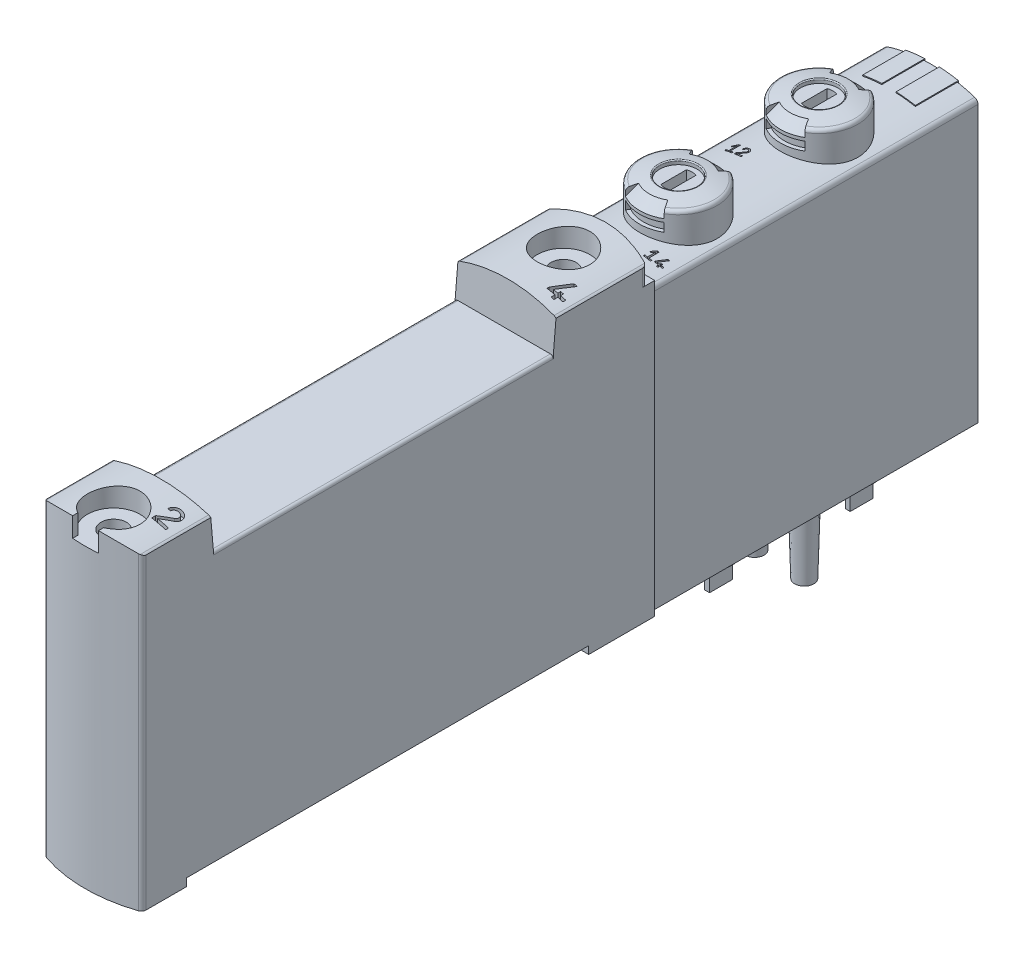
from build123d import *

# Parameters (mm, degrees)
BOSS_EXTRUDE1_DEPTH          = 34
CUT_EXTRUDE1_DEPTH           = 6
CUT_EXTRUDE1_DEPTH_BACK      = 6
SKETCH2_W                    = 34.1
SKETCH2_H                    = 0.4
CUT_EXTRUDE2_DEPTH           = 1.9
CUT_EXTRUDE3_DEPTH           = 1.9
SKETCH9_W                    = 0.5
SKETCH9_H                    = 2.4
BOSS_EXTRUDE2_DEPTH          = 2.5
SKETCH10_W                   = 0.5
SKETCH10_H                   = 2.4
BOSS_EXTRUDE3_DEPTH          = 2.5
SKETCH11_W                   = 0.5
SKETCH11_H                   = 2.4
BOSS_EXTRUDE4_DEPTH          = 2.5
SKETCH12_W                   = 0.5
SKETCH12_H                   = 2.4
BOSS_EXTRUDE5_DEPTH          = 2.5
CUT_REVOLVE1_ANGLE           = 30
CUT_REVOLVE1_OTHER_WAY_ANGLE = 30
CUT_REVOLVE2_ANGLE           = 30
CUT_REVOLVE2_OTHER_WAY_ANGLE = 30
CUT_EXTRUDE4_DEPTH           = 1.7
CUT_REVOLVE3_ANGLE           = 30
CUT_REVOLVE3_OTHER_WAY_ANGLE = 30
CUT_REVOLVE4_ANGLE           = 30
CUT_REVOLVE4_OTHER_WAY_ANGLE = 30
CUT_EXTRUDE5_DEPTH           = 1.7
BOSS_EXTRUDE6_DEPTH          = 4.5
BOSS_EXTRUDE7_DEPTH          = 4.5
BOSS_EXTRUDE8_DEPTH          = 33.1
CUT_EXTRUDE6_DEPTH           = 10
CUT_EXTRUDE6_DEPTH_BACK      = 10
CUT_EXTRUDE7_DEPTH           = 10
CUT_EXTRUDE8_DEPTH           = 10
CUT_EXTRUDE8_DEPTH_BACK      = 10
SKETCH26_W                   = 42
SKETCH26_H                   = 1
CUT_EXTRUDE9_DEPTH           = 55
CUT_EXTRUDE10_DEPTH          = 35.5
CUT_EXTRUDE11_DEPTH          = 2.1
CUT_EXTRUDE11_DEPTH_BACK     = 2.1
SKETCH30_W                   = 1.325
SKETCH30_H                   = 31
CUT_EXTRUDE12_DEPTH          = 3.5
CUT_EXTRUDE12_DEPTH_BACK     = 3.5
CUT_EXTRUDE13_DEPTH          = 3.5
CUT_EXTRUDE13_DEPTH_BACK     = 3.5
CUT_EXTRUDE14_DEPTH          = 3.5
CUT_EXTRUDE14_DEPTH_BACK     = 3.5
CUT_EXTRUDE15_DEPTH          = 3.5
CUT_EXTRUDE15_DEPTH_BACK     = 3.5
CUT_EXTRUDE16_DEPTH          = 1
CUT_EXTRUDE16_DEPTH_BACK     = 1
CUT_EXTRUDE17_DEPTH          = 1
CUT_EXTRUDE17_DEPTH_BACK     = 1


with BuildPart() as part:
    # Sketch1 → Boss-Extrude1 (new body)
    with BuildSketch(Plane.XY.offset(-23.2)):
        with BuildLine():
            Line((-4.9, 29.216294728), (-4.9, 0))
            Line((-4.9, 0), (4.9, 0))
            Line((4.9, 0), (4.9, 29.216294728))
            ThreePointArc((4.9, 29.216294728), (4.803647166, 29.511369236), (4.551724138, 29.692718684))
            ThreePointArc((4.551724138, 29.692718684), (0, 30.4), (-4.551724138, 29.692718684))
            ThreePointArc((-4.551724138, 29.692718684), (-4.803647166, 29.511369236), (-4.9, 29.216294728))
        make_face()
    extrude(amount=BOSS_EXTRUDE1_DEPTH)

    # Sketch2 → Cut-Extrude1 (cut, two sides: drawn at the far end of the back side and taken through both)
    with BuildSketch(Plane(origin=(0, 0, 0), x_dir=(0, 0, -1), z_dir=(1, 0, 0)).offset(-CUT_EXTRUDE1_DEPTH_BACK)):
        with Locations((6.17, 0.2)):
            Rectangle(SKETCH2_W, SKETCH2_H)
    extrude(amount=CUT_EXTRUDE1_DEPTH + CUT_EXTRUDE1_DEPTH_BACK, mode=Mode.SUBTRACT)

    # Sketch3 → Cut-Extrude2 (cut)
    with BuildSketch(Plane(origin=(0, 0, 0), x_dir=(1, 0, 0), z_dir=(0, 1, 0))):
        with BuildLine():
            Line((-3.15, 2.465258607), (-3.15, -2.465258607))
            ThreePointArc((-3.15, -2.465258607), (0, -4), (3.15, -2.465258607))
            Line((3.15, -2.465258607), (3.15, 2.465258607))
            ThreePointArc((3.15, 2.465258607), (0, 4), (-3.15, 2.465258607))
        make_face()
    extrude(amount=CUT_EXTRUDE2_DEPTH, mode=Mode.SUBTRACT)

    # Sketch4 → Cut-Extrude3 (cut)
    with BuildSketch(Plane(origin=(0, 0, 0), x_dir=(1, 0, 0), z_dir=(0, 1, 0))):
        with BuildLine():
            Line((-3.15, 17.165258607), (-3.15, 12.234741393))
            ThreePointArc((-3.15, 12.234741393), (0, 10.7), (3.15, 12.234741393))
            Line((3.15, 12.234741393), (3.15, 17.165258607))
            ThreePointArc((3.15, 17.165258607), (0, 18.7), (-3.15, 17.165258607))
        make_face()
    extrude(amount=CUT_EXTRUDE3_DEPTH, mode=Mode.SUBTRACT)

    # Sketch5 → Revolve1 (revolve)
    with BuildSketch(Plane(origin=(0, 0, 0), x_dir=(0, 0, -1), z_dir=(1, 0, 0))):
        Polygon((0, 2.1), (3.05, 2.1), (3.05, 1.1), (2.25, 1.1), (2.25, -1.4), (2.65, -1.4), (2.65, -1.72), (2.430606898, -2.1), (0, -2.1), align=None)
    revolve(axis=Axis((0, -2.1, 0), (0, 1, 0)))

    # Sketch6 → Revolve2 (revolve)
    with BuildSketch(Plane(origin=(0, 0, 0), x_dir=(0, 0, -1), z_dir=(1, 0, 0))):
        Polygon((14.7, 2.1), (17.75, 2.1), (17.75, 1.1), (16.95, 1.1), (16.95, -1.4), (17.35, -1.4), (17.35, -1.72), (17.130606898, -2.1), (14.7, -2.1), align=None)
    revolve(axis=Axis((0, -2.1, -14.7), (0, 1, 0)))

    # Sketch7 → Revolve3 (revolve)
    with BuildSketch(Plane.XY.offset(-7.35)):
        with BuildLine():
            Line((2.6, 0.4), (3.8, 0.4))
            Line((3.8, 0.4), (3.6, -6.9))
            ThreePointArc((3.6, -6.9), (3.106540729, -7.021444616), (2.6, -7.06227766))
            Line((2.6, -7.06227766), (2.6, 0.4))
        make_face()
    revolve(axis=Axis((2.6, -7.06227766, -7.35), (0, 1, 0)))

    # Sketch8 → Revolve4 (revolve)
    with BuildSketch(Plane.XY.offset(-7.35)):
        with BuildLine():
            Line((-2.6, 0.4), (-1.4, 0.4))
            Line((-1.4, 0.4), (-1.6, -6.9))
            ThreePointArc((-1.6, -6.9), (-2.093459271, -7.021444616), (-2.6, -7.06227766))
            Line((-2.6, -7.06227766), (-2.6, 0.4))
        make_face()
    revolve(axis=Axis((-2.6, -7.06227766, -7.35), (0, 1, 0)))

    # Sketch9 → Boss-Extrude2 (add)
    with BuildSketch(Plane(origin=(0, -2.1, 0), x_dir=(-1, 0, 0), z_dir=(0, -1, 0))):
        with Locations((-1, 0)):
            Rectangle(SKETCH9_W, SKETCH9_H)
    extrude(amount=BOSS_EXTRUDE2_DEPTH)

    # Sketch10 → Boss-Extrude3 (add)
    with BuildSketch(Plane(origin=(0, -2.1, 0), x_dir=(-1, 0, 0), z_dir=(0, -1, 0))):
        with Locations((1, 0)):
            Rectangle(SKETCH10_W, SKETCH10_H)
    extrude(amount=BOSS_EXTRUDE3_DEPTH)

    # Sketch11 → Boss-Extrude4 (add)
    with BuildSketch(Plane(origin=(0, -2.1, 0), x_dir=(-1, 0, 0), z_dir=(0, -1, 0))):
        with Locations((-1, 14.7)):
            Rectangle(SKETCH11_W, SKETCH11_H)
    extrude(amount=BOSS_EXTRUDE4_DEPTH)

    # Sketch12 → Boss-Extrude5 (add)
    with BuildSketch(Plane(origin=(0, -2.1, 0), x_dir=(-1, 0, 0), z_dir=(0, -1, 0))):
        with Locations((1, 14.7)):
            Rectangle(SKETCH12_W, SKETCH12_H)
    extrude(amount=BOSS_EXTRUDE5_DEPTH)

    # Sketch13 → Revolve5 (revolve)
    with BuildSketch(Plane(origin=(0, 0, 0), x_dir=(0, 0, -1), z_dir=(1, 0, 0))):
        with BuildLine():
            Line((-3.2, 33.13), (-1.25, 33.13))
            Line((-1.25, 33.13), (-1.25, 33.458302748))
            ThreePointArc((-1.25, 33.458302748), (-1.215666434, 33.533721045), (-1.136241611, 33.55735176))
            ThreePointArc((-1.136241611, 33.55735176), (-0.28833743, 33.414694053), (0.549999769, 33.223687608))
            ThreePointArc((0.549999769, 33.223687608), (0.766227693, 33.081338282), (0.85, 32.836389214))
            Line((0.85, 32.836389214), (0.85, 28.4))
            Line((0.85, 28.4), (-3.2, 28.4))
            Line((-3.2, 28.4), (-3.2, 33.13))
        make_face()
    revolve(axis=Axis((0, 28.4, 3.2), (0, 1, 0)))

    # Sketch14 → Revolve6 (revolve)
    with BuildSketch(Plane(origin=(0, 0, 0), x_dir=(0, 0, -1), z_dir=(1, 0, 0))):
        with BuildLine():
            Line((11.5, 33.13), (13.45, 33.13))
            Line((13.45, 33.13), (13.45, 33.458302748))
            ThreePointArc((13.45, 33.458302748), (13.484333566, 33.533721045), (13.563758389, 33.55735176))
            ThreePointArc((13.563758389, 33.55735176), (14.411662804, 33.414694007), (15.250000231, 33.223687489))
            ThreePointArc((15.250000231, 33.223687489), (15.466227839, 33.081338094), (15.55, 32.836389214))
            Line((15.55, 32.836389214), (15.55, 28.4))
            Line((15.55, 28.4), (11.5, 28.4))
            Line((11.5, 28.4), (11.5, 33.13))
        make_face()
    revolve(axis=Axis((0, 28.4, -11.5), (0, 1, 0)))

    # Sketch15 → Cut-Revolve1 (revolve, cut)
    with BuildSketch(Plane(origin=(0, 0, 0), x_dir=(0, 0, -1), z_dir=(1, 0, 0))):
        Polygon((-0.47, 33.7), (0.9, 32.33), (0.9, 32.05), (0.45, 32.05), (0.45, 31.15), (0.9, 31.15), (0.9, 30.5), (1.3, 30.5), (1.3, 33.7), align=None)
    revolve(axis=Axis((0, 30.5, 3.2), (0, -1, 0)), revolution_arc=CUT_REVOLVE1_ANGLE, mode=Mode.SUBTRACT)

    # Sketch15 → Cut-Revolve1 other way (revolve, cut)
    with BuildSketch(Plane(origin=(0, 0, 0), x_dir=(0, 0, -1), z_dir=(1, 0, 0))):
        Polygon((-0.47, 33.7), (0.9, 32.33), (0.9, 32.05), (0.45, 32.05), (0.45, 31.15), (0.9, 31.15), (0.9, 30.5), (1.3, 30.5), (1.3, 33.7), align=None)
    revolve(axis=Axis((0, 30.5, 3.2), (0, 1, 0)), revolution_arc=CUT_REVOLVE1_OTHER_WAY_ANGLE, mode=Mode.SUBTRACT)

    # Sketch16 → Cut-Revolve2 (revolve, cut)
    with BuildSketch(Plane(origin=(0, 0, 0), x_dir=(0, 0, -1), z_dir=(1, 0, 0))):
        Polygon((-7.7, 30.5), (-7.3, 30.5), (-7.3, 31.15), (-6.85, 31.15), (-6.85, 32.05), (-7.3, 32.05), (-7.3, 32.33), (-5.93, 33.7), (-7.7, 33.7), align=None)
    revolve(axis=Axis((0, 33.7, 3.2), (0, 1, 0)), revolution_arc=CUT_REVOLVE2_ANGLE, mode=Mode.SUBTRACT)

    # Sketch16 → Cut-Revolve2 other way (revolve, cut)
    with BuildSketch(Plane(origin=(0, 0, 0), x_dir=(0, 0, -1), z_dir=(1, 0, 0))):
        Polygon((-7.7, 30.5), (-7.3, 30.5), (-7.3, 31.15), (-6.85, 31.15), (-6.85, 32.05), (-7.3, 32.05), (-7.3, 32.33), (-5.93, 33.7), (-7.7, 33.7), align=None)
    revolve(axis=Axis((0, 33.7, 3.2), (0, -1, 0)), revolution_arc=CUT_REVOLVE2_OTHER_WAY_ANGLE, mode=Mode.SUBTRACT)

    # Sketch17 → Cut-Extrude4 (cut)
    with BuildSketch(Plane(origin=(0, 33.13, 0), x_dir=(1, 0, 0), z_dir=(0, 1, 0))):
        with BuildLine():
            Line((0.5, -4.534400615), (0.5, -1.865599385))
            ThreePointArc((0.5, -1.865599385), (0, -1.775), (-0.5, -1.865599385))
            Line((-0.5, -1.865599385), (-0.5, -4.534400615))
            ThreePointArc((-0.5, -4.534400615), (0, -4.625), (0.5, -4.534400615))
        make_face()
    extrude(amount=-CUT_EXTRUDE4_DEPTH, mode=Mode.SUBTRACT)

    # Sketch18 → Cut-Revolve3 (revolve, cut)
    with BuildSketch(Plane(origin=(0, 0, 0), x_dir=(0, 0, -1), z_dir=(1, 0, 0))):
        Polygon((14.23, 33.7), (15.6, 32.33), (15.6, 32.05), (15.15, 32.05), (15.15, 31.15), (15.6, 31.15), (15.6, 30.5), (16, 30.5), (16, 33.7), align=None)
    revolve(axis=Axis((0, 30.5, -11.5), (0, -1, 0)), revolution_arc=CUT_REVOLVE3_ANGLE, mode=Mode.SUBTRACT)

    # Sketch18 → Cut-Revolve3 other way (revolve, cut)
    with BuildSketch(Plane(origin=(0, 0, 0), x_dir=(0, 0, -1), z_dir=(1, 0, 0))):
        Polygon((14.23, 33.7), (15.6, 32.33), (15.6, 32.05), (15.15, 32.05), (15.15, 31.15), (15.6, 31.15), (15.6, 30.5), (16, 30.5), (16, 33.7), align=None)
    revolve(axis=Axis((0, 30.5, -11.5), (0, 1, 0)), revolution_arc=CUT_REVOLVE3_OTHER_WAY_ANGLE, mode=Mode.SUBTRACT)

    # Sketch19 → Cut-Revolve4 (revolve, cut)
    with BuildSketch(Plane(origin=(0, 0, 0), x_dir=(0, 0, -1), z_dir=(1, 0, 0))):
        Polygon((7, 30.5), (7.4, 30.5), (7.4, 31.15), (7.85, 31.15), (7.85, 32.05), (7.4, 32.05), (7.4, 32.33), (8.77, 33.7), (7, 33.7), align=None)
    revolve(axis=Axis((0, 33.7, -11.5), (0, 1, 0)), revolution_arc=CUT_REVOLVE4_ANGLE, mode=Mode.SUBTRACT)

    # Sketch19 → Cut-Revolve4 other way (revolve, cut)
    with BuildSketch(Plane(origin=(0, 0, 0), x_dir=(0, 0, -1), z_dir=(1, 0, 0))):
        Polygon((7, 30.5), (7.4, 30.5), (7.4, 31.15), (7.85, 31.15), (7.85, 32.05), (7.4, 32.05), (7.4, 32.33), (8.77, 33.7), (7, 33.7), align=None)
    revolve(axis=Axis((0, 33.7, -11.5), (0, -1, 0)), revolution_arc=CUT_REVOLVE4_OTHER_WAY_ANGLE, mode=Mode.SUBTRACT)

    # Sketch20 → Cut-Extrude5 (cut)
    with BuildSketch(Plane(origin=(0, 33.13, 0), x_dir=(1, 0, 0), z_dir=(0, 1, 0))):
        with BuildLine():
            Line((0.5, 10.165599385), (0.5, 12.834400615))
            ThreePointArc((0.5, 12.834400615), (0, 12.925), (-0.5, 12.834400615))
            Line((-0.5, 12.834400615), (-0.5, 10.165599385))
            ThreePointArc((-0.5, 10.165599385), (0, 10.075), (0.5, 10.165599385))
        make_face()
    extrude(amount=-CUT_EXTRUDE5_DEPTH, mode=Mode.SUBTRACT)

    # Sketch21 → Boss-Extrude6 (add)
    with BuildSketch(Plane.XY.offset(-23.3)):
        with BuildLine():
            Line((0.75, 30.481362671), (0.75, 27))
            Line((0.75, 27), (2.75, 27))
            Line((2.75, 27), (2.75, 30.247474533))
            ThreePointArc((2.75, 30.247474533), (1.753903052, 30.397793974), (0.75, 30.481362671))
        make_face()
    extrude(amount=BOSS_EXTRUDE6_DEPTH)

    # Sketch22 → Boss-Extrude7 (add)
    with BuildSketch(Plane.XY.offset(-23.3)):
        with BuildLine():
            Line((-2.75, 30.247474533), (-2.75, 27))
            Line((-2.75, 27), (-0.75, 27))
            Line((-0.75, 27), (-0.75, 30.481362671))
            ThreePointArc((-0.75, 30.481362671), (-1.753903052, 30.397793974), (-2.75, 30.247474533))
        make_face()
    extrude(amount=BOSS_EXTRUDE7_DEPTH)

    # Sketch23 → Boss-Extrude8 (add)
    with BuildSketch(Plane(origin=(0, 0, 0), x_dir=(1, 0, 0), z_dir=(0, 1, 0))):
        with BuildLine():
            Line((5.125, -63.942611651), (5.125, -10.8))
            Line((5.125, -10.8), (-5.125, -10.8))
            Line((-5.125, -10.8), (-5.125, -63.942611651))
            ThreePointArc((-5.125, -63.942611651), (-5.031042719, -64.234380927), (-4.784482759, -64.416494812))
            ThreePointArc((-4.784482759, -64.416494812), (0, -65.2), (4.784482759, -64.416494812))
            ThreePointArc((4.784482759, -64.416494812), (5.031042719, -64.234380927), (5.125, -63.942611651))
        make_face()
    extrude(amount=BOSS_EXTRUDE8_DEPTH)

    # Sketch24 → Cut-Extrude6 (cut, two sides: drawn at the far end of the back side and taken through both)
    with BuildSketch(Plane(origin=(0, 0, 0), x_dir=(0, 0, -1), z_dir=(1, 0, 0)).offset(-CUT_EXTRUDE6_DEPTH_BACK)):
        Polygon((-57.774886635, 38.9), (-56.9, 28.9), (-21.4, 28.9), (-20.525113365, 38.9), align=None)
    extrude(amount=CUT_EXTRUDE6_DEPTH + CUT_EXTRUDE6_DEPTH_BACK, mode=Mode.SUBTRACT)

    # Sketch25 → Cut-Extrude7 (cut)
    with BuildSketch(Plane(origin=(0, 30.4, 0), x_dir=(1, 0, 0), z_dir=(0, 1, 0))):
        with BuildLine():
            Line((-5.125, -8.8), (-5.125, -12.057388349))
            ThreePointArc((-5.125, -12.057388349), (-5.031042719, -11.765619073), (-4.784482759, -11.583505188))
            ThreePointArc((-4.784482759, -11.583505188), (0, -10.8), (4.784482759, -11.583505188))
            ThreePointArc((4.784482759, -11.583505188), (5.031042719, -11.765619073), (5.125, -12.057388349))
            Line((5.125, -12.057388349), (5.125, -8.8))
            Line((5.125, -8.8), (-5.125, -8.8))
        make_face()
    extrude(amount=CUT_EXTRUDE7_DEPTH, mode=Mode.SUBTRACT)

    # Sketch26 → Cut-Extrude8 (cut, two sides: drawn at the far end of the back side and taken through both)
    with BuildSketch(Plane(origin=(0, 0, 0), x_dir=(0, 0, -1), z_dir=(1, 0, 0)).offset(-CUT_EXTRUDE8_DEPTH_BACK)):
        with Locations((-38.7, 0.3)):
            Rectangle(SKETCH26_W, SKETCH26_H)
    extrude(amount=CUT_EXTRUDE8_DEPTH + CUT_EXTRUDE8_DEPTH_BACK, mode=Mode.SUBTRACT)

    # Sketch27 → Cut-Extrude9 (cut)
    with BuildSketch(Plane.XY.offset(10.8)):
        with BuildLine():
            Line((-5.25, 35.1), (-5.25, 31.799908759))
            ThreePointArc((-5.25, 31.799908759), (-5.157367495, 32.089825513), (-4.913793103, 32.272319406))
            ThreePointArc((-4.913793103, 32.272319406), (0, 33.1), (4.913793103, 32.272319406))
            ThreePointArc((4.913793103, 32.272319406), (5.157367495, 32.089825513), (5.25, 31.799908759))
            Line((5.25, 31.799908759), (5.25, 35.1))
            Line((5.25, 35.1), (-5.25, 35.1))
        make_face()
    extrude(amount=CUT_EXTRUDE9_DEPTH, mode=Mode.SUBTRACT)

    # Sketch28 → Cut-Extrude10 (cut)
    with BuildSketch(Plane.XY.offset(21.4)):
        with BuildLine():
            Line((-4.825, 28.9), (4.825, 28.9))
            ThreePointArc((4.825, 28.9), (5.037132034, 28.812132034), (5.125, 28.6))
            Line((5.125, 28.6), (5.125, 33.6))
            Line((5.125, 33.6), (-5.125, 33.6))
            Line((-5.125, 33.6), (-5.125, 28.6))
            ThreePointArc((-5.125, 28.6), (-5.037132034, 28.812132034), (-4.825, 28.9))
        make_face()
    extrude(amount=CUT_EXTRUDE10_DEPTH, mode=Mode.SUBTRACT)

    # Sketch29 → Cut-Extrude11 (cut, two sides: drawn at the far end of the back side and taken through both)
    with BuildSketch(Plane(origin=(0, 33.1, 0), x_dir=(1, 0, 0), z_dir=(0, 1, 0)).offset(-CUT_EXTRUDE11_DEPTH_BACK)):
        with BuildLine():
            Line((-1.35, -64.59582971), (-1.35, -66))
            Line((-1.35, -66), (1.35, -66))
            Line((1.35, -66), (1.35, -64.59582971))
            ThreePointArc((1.35, -64.59582971), (0, -59.45), (-1.35, -64.59582971))
        make_face()
    extrude(amount=CUT_EXTRUDE11_DEPTH + CUT_EXTRUDE11_DEPTH_BACK, mode=Mode.SUBTRACT)

    # Sketch30 → Cut-Revolve5 (revolve, cut)
    with BuildSketch(Plane(origin=(0, 0, 0), x_dir=(0, 0, -1), z_dir=(1, 0, 0))):
        with Locations((-61.5375, 15.5)):
            Rectangle(SKETCH30_W, SKETCH30_H)
    revolve(axis=Axis((0, 0, 62.2), (0, 1, 0)), mode=Mode.SUBTRACT)

    # Sketch31 → Cut-Revolve6 (revolve, cut)
    with BuildSketch(Plane(origin=(0, 0, 0), x_dir=(0, 0, -1), z_dir=(1, 0, 0))):
        Polygon((-15.2, 33.2), (-12.45, 33.2), (-12.45, 31), (-13.875, 31), (-13.875, 0), (-15.2, 0), align=None)
    revolve(axis=Axis((0, 0, 15.2), (0, 1, 0)), mode=Mode.SUBTRACT)

    # Sketch32 → Cut-Revolve7 (revolve, cut)
    with BuildSketch(Plane(origin=(0, 0, 0), x_dir=(0, 0, -1), z_dir=(1, 0, 0))):
        Polygon((-40.2, 9.8), (-38.1, 9.8), (-38.1, 1.8), (-37.4, 1.8), (-37.4, 0.8), (-40.2, 0.8), align=None)
    revolve(axis=Axis((0, 0.8, 40.2), (0, 1, 0)), mode=Mode.SUBTRACT)

    # Sketch33 → Cut-Revolve8 (revolve, cut)
    with BuildSketch(Plane(origin=(-1.55, 0, 0), x_dir=(0, 0, -1), z_dir=(1, 0, 0))):
        Polygon((-29.1, 9.8), (-27, 9.8), (-27, 1.8), (-26.3, 1.8), (-26.3, 0.8), (-29.1, 0.8), align=None)
    revolve(axis=Axis((-1.55, 0.8, 29.1), (0, 1, 0)), mode=Mode.SUBTRACT)

    # Sketch34 → Cut-Revolve9 (revolve, cut)
    with BuildSketch(Plane(origin=(-1.55, 0, 0), x_dir=(0, 0, -1), z_dir=(1, 0, 0))):
        Polygon((-46.1, 9.8), (-44, 9.8), (-44, 1.8), (-43.3, 1.8), (-43.3, 0.8), (-46.1, 0.8), align=None)
    revolve(axis=Axis((-1.55, 0.8, 46.1), (0, 1, 0)), mode=Mode.SUBTRACT)

    # Sketch35 → Cut-Revolve10 (revolve, cut)
    with BuildSketch(Plane(origin=(1.55, 0, 0), x_dir=(0, 0, -1), z_dir=(1, 0, 0))):
        Polygon((-34.3, 9.8), (-32.2, 9.8), (-32.2, 1.8), (-31.5, 1.8), (-31.5, 0.8), (-34.3, 0.8), align=None)
    revolve(axis=Axis((1.55, 0.8, 34.3), (0, 1, 0)), mode=Mode.SUBTRACT)

    # Sketch36 → Cut-Revolve11 (revolve, cut)
    with BuildSketch(Plane(origin=(1.55, 0, 0), x_dir=(0, 0, -1), z_dir=(1, 0, 0))):
        Polygon((-51.3, 9.8), (-49.2, 9.8), (-49.2, 1.8), (-48.5, 1.8), (-48.5, 0.8), (-51.3, 0.8), align=None)
    revolve(axis=Axis((1.55, 0.8, 51.3), (0, 1, 0)), mode=Mode.SUBTRACT)

    # Sketch37 → Cut-Extrude12 (cut, two sides: drawn at the far end of the back side and taken through both)
    with BuildSketch(Plane(origin=(0, 33.1, 0), x_dir=(1, 0, 0), z_dir=(0, 1, 0)).offset(-CUT_EXTRUDE12_DEPTH_BACK)):
        Polygon((-3.398476194, 5.738028118), (-3.297824684, 5.667551171), (-3.075, 5.985777799), (-3.075, 5.15), (-3.375, 5.15), (-3.375, 5), (-2.625, 5), (-2.625, 5.15), (-2.925, 5.15), (-2.925, 6.2), (-3.075, 6.2), align=None)
    extrude(amount=CUT_EXTRUDE12_DEPTH + CUT_EXTRUDE12_DEPTH_BACK, mode=Mode.SUBTRACT)

    # Sketch38 → Cut-Extrude13 (cut, two sides: drawn at the far end of the back side and taken through both)
    with BuildSketch(Plane(origin=(0, 33.1, 0), x_dir=(1, 0, 0), z_dir=(0, 1, 0)).offset(-CUT_EXTRUDE13_DEPTH_BACK)):
        with BuildLine():
            Line((-2.3625, 5.8375), (-2.2125, 5.8375))
            ThreePointArc((-2.2125, 5.8375), (-1.915590111, 6.03251595), (-1.854559099, 5.682570356))
            Line((-1.854559099, 5.682570356), (-2.3625, 5.205738549))
            Line((-2.3625, 5.205738549), (-2.3625, 5))
            Line((-2.3625, 5), (-1.6375, 5))
            Line((-1.6375, 5), (-1.6375, 5.15))
            Line((-1.6375, 5.15), (-2.202713816, 5.15))
            Line((-2.202713816, 5.15), (-1.751894934, 5.573208255))
            ThreePointArc((-1.751894934, 5.573208255), (-1.85600666, 6.170174267), (-2.3625, 5.8375))
        make_face()
    extrude(amount=CUT_EXTRUDE13_DEPTH + CUT_EXTRUDE13_DEPTH_BACK, mode=Mode.SUBTRACT)

    # Sketch39 → Cut-Extrude14 (cut, two sides: drawn at the far end of the back side and taken through both)
    with BuildSketch(Plane(origin=(0, 33.1, 0), x_dir=(1, 0, 0), z_dir=(0, 1, 0)).offset(-CUT_EXTRUDE14_DEPTH_BACK)):
        Polygon((2.101523806, -8.261971882), (2.202175316, -8.332448829), (2.425, -8.014222201), (2.425, -8.85), (2.125, -8.85), (2.125, -9), (2.875, -9), (2.875, -8.85), (2.575, -8.85), (2.575, -7.8), (2.425, -7.8), align=None)
    extrude(amount=CUT_EXTRUDE14_DEPTH + CUT_EXTRUDE14_DEPTH_BACK, mode=Mode.SUBTRACT)

    # Sketch40 → Cut-Extrude15 (cut, two sides: drawn at the far end of the back side and taken through both)
    with BuildSketch(Plane(origin=(0, 33.1, 0), x_dir=(1, 0, 0), z_dir=(0, 1, 0)).offset(-CUT_EXTRUDE15_DEPTH_BACK)):
        Polygon((3.085, -8.8), (3.5, -8.8), (3.5, -9), (3.65, -9), (3.65, -8.8), (3.915, -8.8), (3.915, -8.65), (3.65, -8.65), (3.65, -8.5), (3.5, -8.5), (3.5, -8.65), (3.269946149, -8.65), (3.666307658, -7.8), (3.50080097, -7.8), (3.085, -8.691688058), align=None)
    extrude(amount=CUT_EXTRUDE15_DEPTH + CUT_EXTRUDE15_DEPTH_BACK, mode=Mode.SUBTRACT)

    # Sketch41 → Cut-Extrude16 (cut, two sides: drawn at the far end of the back side and taken through both)
    with BuildSketch(Plane(origin=(0, 33.1, 0), x_dir=(1, 0, 0), z_dir=(0, 1, 0)).offset(-CUT_EXTRUDE16_DEPTH_BACK)):
        Polygon((2.67, -19.6), (3.5, -19.6), (3.5, -20), (3.8, -20), (3.8, -19.6), (4.33, -19.6), (4.33, -19.3), (3.8, -19.3), (3.8, -19), (3.5, -19), (3.5, -19.3), (3.039892297, -19.3), (3.832615316, -17.6), (3.501601941, -17.6), (2.67, -19.383376117), align=None)
    extrude(amount=CUT_EXTRUDE16_DEPTH + CUT_EXTRUDE16_DEPTH_BACK, mode=Mode.SUBTRACT)

    # Sketch42 → Cut-Extrude17 (cut, two sides: drawn at the far end of the back side and taken through both)
    with BuildSketch(Plane(origin=(0, 33.1, 0), x_dir=(1, 0, 0), z_dir=(0, 1, 0)).offset(-CUT_EXTRUDE17_DEPTH_BACK)):
        with BuildLine():
            Line((2.775, -59.325), (3.075, -59.325))
            ThreePointArc((3.075, -59.325), (3.668819777, -58.9349681), (3.790881801, -59.634859287))
            Line((3.790881801, -59.634859287), (2.775, -60.588522903))
            Line((2.775, -60.588522903), (2.775, -61))
            Line((2.775, -61), (4.225, -61))
            Line((4.225, -61), (4.225, -60.7))
            Line((4.225, -60.7), (3.094572368, -60.7))
            Line((3.094572368, -60.7), (3.996210131, -59.85358349))
            ThreePointArc((3.996210131, -59.85358349), (3.787986679, -58.659651465), (2.775, -59.325))
        make_face()
    extrude(amount=CUT_EXTRUDE17_DEPTH + CUT_EXTRUDE17_DEPTH_BACK, mode=Mode.SUBTRACT)


solid = part.part
